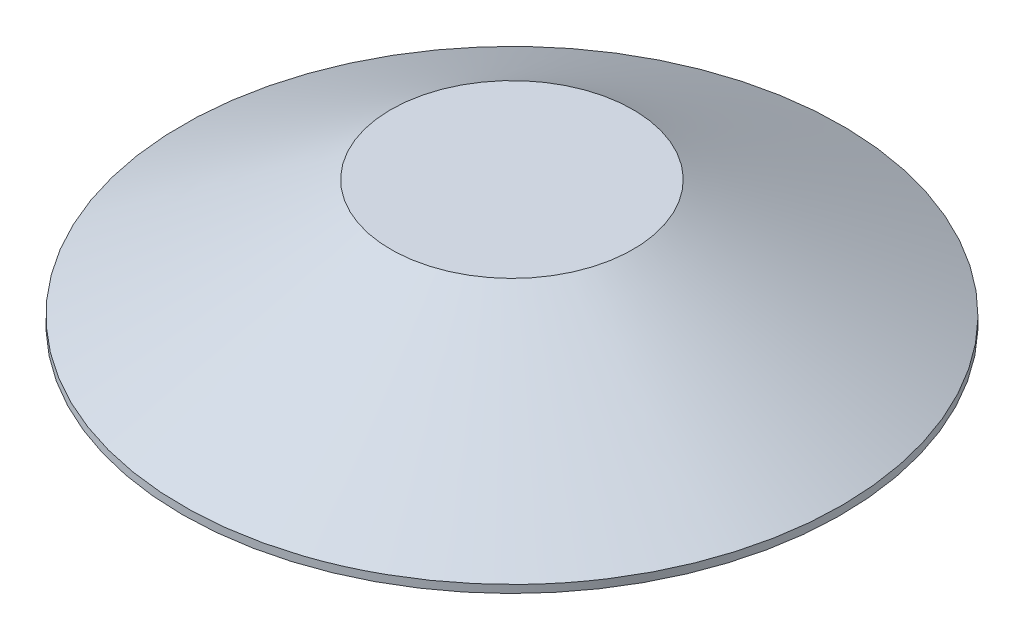
from build123d import *

# Parameters (mm, degrees)
SKETCH3_R           = 4200
BOSS_EXTRUDE1_DEPTH = 100


with BuildPart() as part:
    # Sketch3 → Boss-Extrude1 (new body)
    with BuildSketch(Plane(origin=(0, 0, 0), x_dir=(1, 0, 0), z_dir=(0, 1, 0))):
        with Locations(Location((0, 0, 0), (0, 0, 270))):
            Circle(SKETCH3_R)
    extrude(amount=BOSS_EXTRUDE1_DEPTH)

    # Loft1: read off the stored shape, not the designer's step
    # Loft1: loft between two sections, ruled curve by curve
    loft1_from = [
        Edge.make_bspline([(-1266.549766078, 1600, -883.031644769), (499.51352346, 1600, -3416.131176926), (3032.613055616, 1600, -1650.067887388), (1266.549766078, 1600, 883.031644769), (-499.51352346, 1600, 3416.131176926), (-3032.613055616, 1600, 1650.067887388), (-1266.549766078, 1600, -883.031644769)], [0, 0, 0, 0, 0.5, 0.5, 0.5, 1, 1, 1, 1], 3, [1, 0.333333333333333, 0.333333333333333, 1, 0.333333333333333, 0.333333333333333, 1]),
    ]
    loft1_to = [
        Edge.make_bspline([(-2566.079011828, 100, -3324.941879952), (4083.804748075, 100, -8457.099903607), (9215.962771731, 100, -1807.216143704), (2566.079011828, 100, 3324.941879952), (-4083.804748075, 100, 8457.099903607), (-9215.962771731, 100, 1807.216143704), (-2566.079011828, 100, -3324.941879952)], [0, 0, 0, 0, 0.5, 0.5, 0.5, 1, 1, 1, 1], 3, [1, 0.333333333333333, 0.333333333333333, 1, 0.333333333333333, 0.333333333333333, 1]),
    ]
    loft1 = Solid(Shell([*[Face.make_surface_from_curves(loft1_from[k], loft1_to[k]) for k in range(1)], Face(Wire(loft1_from)), Face(Wire(loft1_to))]))
    add(loft1)


solid = part.part
